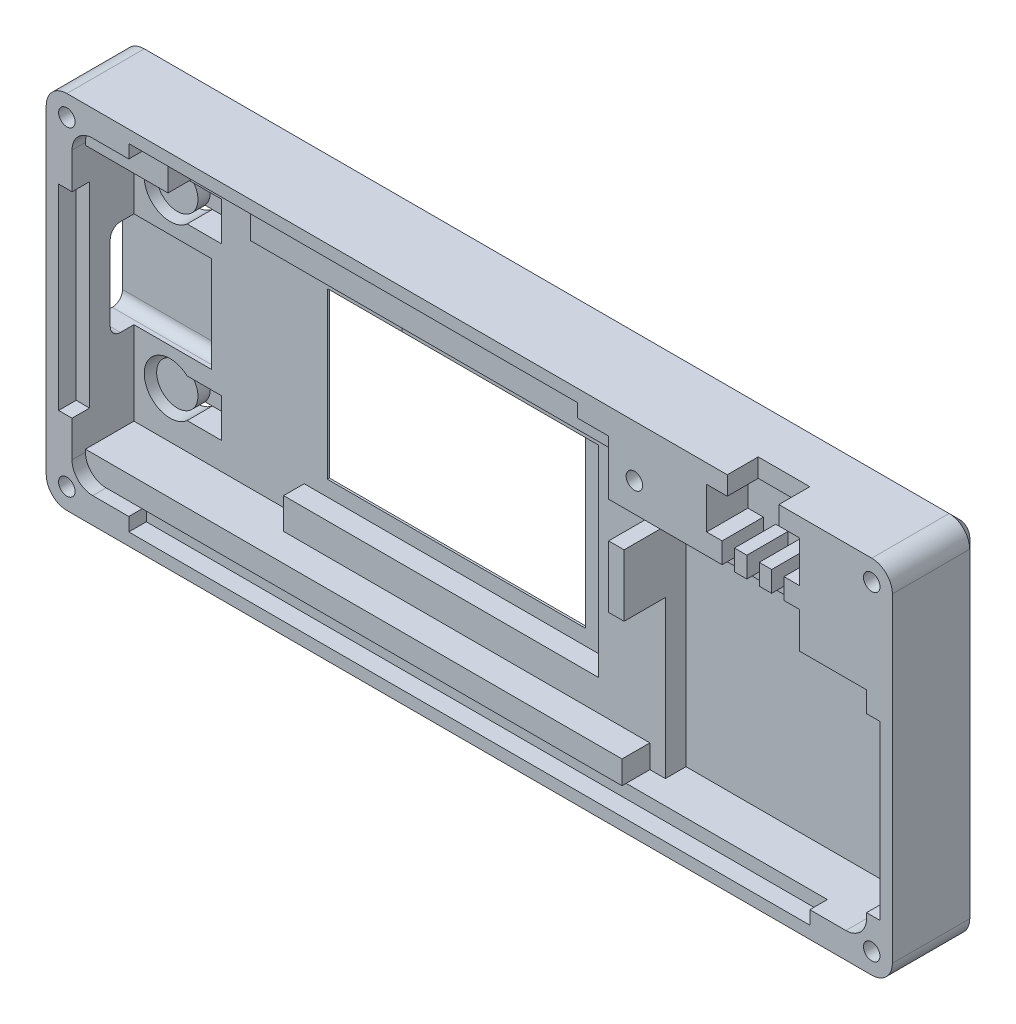
from build123d import *
from build123d.topology import SkipClean

# Parameters (mm, degrees)
SKETCH1_W                = 82
SKETCH1_H                = 35
SKETCH1_W_2              = 25
SKETCH1_H_2              = 16
BOSS_EXTRUDE1_DEPTH      = 2.5
BOSS_EXTRUDE2_DEPTH      = 2
SKETCH1_4_W              = 82
SKETCH1_4_H              = 35
SKETCH1_4_W_2            = 1.5
SKETCH1_4_H_2            = 6
BOSS_EXTRUDE3_DEPTH      = 6
BOSS_EXTRUDE4_DEPTH      = 4.7
SKETCH3_W                = 3.7
SKETCH3_H                = 9.3
CUT_EXTRUDE1_DEPTH       = 10
FILLET1_R                = 1
CUT_EXTRUDE2_DEPTH       = 10
CUT_EXTRUDE5_START       = -2.5
CUT_EXTRUDE5_DEPTH       = 0.7
SKETCH8_W                = 5
SKETCH8_H                = 1.8
SKETCH8_W_2              = 9
SKETCH8_H_2              = 4
CUT_EXTRUDE10_DEPTH      = 4
BOSS_EXTRUDE7_START      = 6
SKETCH1_7_W              = 82
SKETCH1_7_H              = 35
SKETCH1_7_W_2            = 1.5
SKETCH1_7_H_2            = 6
BOSS_EXTRUDE7_DEPTH      = 6
BOSS_EXTRUDE9_START      = -4
SKETCH8_4_W              = 5
SKETCH8_4_H              = 1.8
BOSS_EXTRUDE9_DEPTH      = 1
BOSS_EXTRUDE10_START     = 12
SKETCH1_8_W              = 82
SKETCH1_8_H              = 35
SKETCH1_8_W_2            = 25
SKETCH1_8_H_2            = 16
SKETCH1_8_W_3            = 1.5
SKETCH1_8_H_3            = 6
BOSS_EXTRUDE10_DEPTH     = 2.5
FILLET3_R                = 2
CHAMFER1_SIZE            = 1
CUT_EXTRUDE14_DEPTH      = 6
CUT_EXTRUDE14_DEPTH_BACK = 33
SKETCH10_R               = 0.8
CUT_EXTRUDE12_START      = -17
SKETCH9_2_W              = 121.746640378
SKETCH9_2_H              = 87.215043388
CUT_EXTRUDE12_DEPTH      = 8.5
CUT_EXTRUDE16_START      = -6
SKETCH14_W               = 1.3
SKETCH14_H               = 19
SKETCH14_W_2             = 66
SKETCH14_H_2             = 1.3
SKETCH14_W_3             = 43.5
SKETCH14_H_3             = 16.7
CUT_EXTRUDE16_DEPTH      = 1.7
CUT_EXTRUDE17_START      = -1.2
CUT_EXTRUDE17_DEPTH      = 1.2
SKETCH16_W               = 8
SKETCH16_H               = 2.25
CUT_EXTRUDE18_DEPTH      = 4.7
CHAMFER2_SIZE            = 2.3
CUT_EXTRUDE19_START      = -0.2
CUT_EXTRUDE19_DEPTH      = 0.2


# Read off the part's stored shape, not the designer's step: Cut-Extrude5, Cut-Extrude19
with BuildPart() as part:
    # Sketch1 → Boss-Extrude1 (new body)
    with BuildSketch(Plane.XY):
        Rectangle(SKETCH1_W, SKETCH1_H)
        with Locations((-7.25, -0.25)):
            Rectangle(SKETCH1_W_2, SKETCH1_H_2, mode=Mode.SUBTRACT)
    extrude(amount=-BOSS_EXTRUDE1_DEPTH)

    # Sketch1<3> → Boss-Extrude2 (add)
    with BuildSketch(Plane.XY):
        Polygon((-38.5, 15), (-38.5, 12.75), (-10.5, 12.75), (-10.5, 9.75), (8.5, 9.75), (8.5, -9.75), (-22, -9.75), (-22, -12.75), (13.5, -12.75), (13.5, -15), (15, -15), (15, 6.2), (38.5, 6.2), (38.5, 15), align=None)
    extrude(amount=BOSS_EXTRUDE2_DEPTH)

    # Sketch1<4> → Boss-Extrude3 (add)
    # profile 1 of 3: a face of its own
    with BuildSketch(Plane.XY):
        Rectangle(SKETCH1_4_W, SKETCH1_4_H)
        Polygon((-38.5, -12.75), (-38.5, 12.75), (-38.5, 15), (13.5, 15), (38.5, 15), (38.5, 6.2), (38.5, -15), (15, -15), (13.5, -15), (-38.5, -15), align=None, mode=Mode.SUBTRACT)
    # profile 2 of 3: a face of its own
    with BuildSketch(Plane.XY):
        Polygon((13.5, 15), (13.5, 12.75), (13.5, 6.2), (15, 6.2), (38.5, 6.2), (38.5, 15), align=None)
    # profile 3 of 3: a face of its own
    with BuildSketch(Plane.XY):
        with Locations((14.25, 3.2)):
            Rectangle(SKETCH1_4_W_2, SKETCH1_4_H_2)
    extrude(amount=BOSS_EXTRUDE3_DEPTH)

    # Sketch1<5> → Boss-Extrude4 (add)
    with BuildSketch(Plane.XY):
        Polygon((-38.5, 12.75), (-10.5, 12.75), (13.5, 12.75), (13.5, 15), (-38.5, 15), align=None)
        Polygon((-22, -12.75), (-38.5, -12.75), (-38.5, -15), (13.5, -15), (13.5, -12.75), align=None)
    extrude(amount=BOSS_EXTRUDE4_DEPTH)

    # Sketch3 → Cut-Extrude1 (cut)
    with BuildSketch(Plane.ZY.offset(41)):
        with Locations((0.45, 0)):
            Rectangle(SKETCH3_W, SKETCH3_H)
    extrude(amount=-CUT_EXTRUDE1_DEPTH, mode=Mode.SUBTRACT)

    # Fillet1
    fillet1_edges = [part.edges().sort_by_distance(p)[0] for p in [
        (-36, -4.65, -1.4),
        (-36, 4.65, -1.4),
        (-39.75, 4.65, 2.3),
        (-39.75, -4.65, 2.3),
    ]]
    fillet(fillet1_edges, radius=FILLET1_R)

    # Sketch4 → Cut-Extrude2 (cut)
    with BuildSketch(Plane(origin=(0, 0, -2.5), x_dir=(-1, 0, 0), z_dir=(0, 0, -1))):
        with BuildLine():
            Line((35, 5.75), (35, 6.25))
            ThreePointArc((35, 6.25), (34.183503419, 6.424258142), (33.509288015, 6.916666667))
            Line((33.509288015, 6.916666667), (30, 6.916666667))
            Line((30, 6.916666667), (30, 6.375))
            Line((30, 6.375), (33.346405431, 6.375))
            ThreePointArc((33.346405431, 6.375), (34.116116524, 5.911464133), (35, 5.75))
        make_face()
        with BuildLine():
            ThreePointArc((33.509288015, 9.583333333), (36.825741858, 9.066496581), (35, 6.25))
            Line((35, 6.25), (35, 5.75))
            ThreePointArc((35, 5.75), (37.338535867, 9.133883476), (33.346405431, 10.125))
            Line((33.346405431, 10.125), (30, 10.125))
            Line((30, 10.125), (30, 9.583333333))
            Line((30, 9.583333333), (33.509288015, 9.583333333))
        make_face()
        with BuildLine():
            ThreePointArc((33.346405431, -10.125), (37.338535867, -9.133883476), (35, -5.75))
            Line((35, -5.75), (35, -6.25))
            ThreePointArc((35, -6.25), (36.825741858, -9.066496581), (33.509288015, -9.583333333))
            Line((33.509288015, -9.583333333), (30, -9.583333333))
            Line((30, -9.583333333), (30, -10.125))
            Line((30, -10.125), (33.346405431, -10.125))
        make_face()
        with BuildLine():
            Line((35, -6.25), (35, -5.75))
            ThreePointArc((35, -5.75), (34.116116524, -5.911464133), (33.346405431, -6.375))
            Line((33.346405431, -6.375), (30, -6.375))
            Line((30, -6.375), (30, -6.916666667))
            Line((30, -6.916666667), (33.509288015, -6.916666667))
            ThreePointArc((33.509288015, -6.916666667), (34.183503419, -6.424258142), (35, -6.25))
        make_face()
    extrude(amount=-CUT_EXTRUDE2_DEPTH, mode=Mode.SUBTRACT)

    # Cut-Extrude5 outline → Cut-Extrude5 (cut)
    with BuildSketch(Plane(origin=(0, 0, -2.5), x_dir=(-1, 0, 0), z_dir=(0, 0, -1)).offset(CUT_EXTRUDE5_START)):
        with BuildLine():
            Line((33.509288015, -6.916666667), (30, -6.916666667))
            Line((30, -6.916666667), (30, -9.583333333))
            Line((30, -9.583333333), (33.509288015, -9.583333333))
            ThreePointArc((33.509288015, -9.583333333), (37, -8.25), (33.509288015, -6.916666667))
        make_face()
        with BuildLine():
            Line((33.509288015, 9.583333333), (30, 9.583333333))
            Line((30, 9.583333333), (30, 6.916666667))
            Line((30, 6.916666667), (33.509288015, 6.916666667))
            ThreePointArc((33.509288015, 6.916666667), (37, 8.25), (33.509288015, 9.583333333))
        make_face()
    extrude(amount=CUT_EXTRUDE5_DEPTH, mode=Mode.SUBTRACT)

    # Sketch8 → Cut-Extrude10 (cut)
    with BuildSketch(Plane.XY.offset(6)):
        with Locations((27.5, 16.6)):
            Rectangle(SKETCH8_W, SKETCH8_H)
        with Locations((27.5, 13.7)):
            Rectangle(SKETCH8_W_2, SKETCH8_H_2)
        Polygon((25.7, 11.7), (24.5, 11.7), (24.5, 9.7), (23, 9.7), (23, 6.2), (32, 6.2), (32, 9.7), (30.5, 9.7), (30.5, 11.7), (29.3, 11.7), (29.3, 9.7), (28.1, 9.7), (28.1, 11.7), (26.9, 11.7), (26.9, 9.7), (25.7, 9.7), align=None)
        Polygon((23, 6.2), (23, 9.7), (13.5, 9.7), (13.5, 6.2), (15, 6.2), align=None)
    extrude(amount=-CUT_EXTRUDE10_DEPTH, mode=Mode.SUBTRACT)

    # Sketch1<7> → Boss-Extrude7 (add)
    # profile 1 of 3: a face of its own
    with BuildSketch(Plane.XY.offset(BOSS_EXTRUDE7_START)):
        Rectangle(SKETCH1_7_W, SKETCH1_7_H)
        Polygon((-38.5, -15), (38.5, -15), (38.5, 6.2), (38.5, 15), (-38.5, 15), (-38.5, 12.75), (-38.5, -12.75), align=None, mode=Mode.SUBTRACT)
    # profile 2 of 3: a face of its own
    with BuildSketch(Plane.XY.offset(BOSS_EXTRUDE7_START)):
        Polygon((13.5, 15), (13.5, 12.75), (13.5, 6.2), (15, 6.2), (38.5, 6.2), (38.5, 15), align=None)
    # profile 3 of 3: a face of its own
    with BuildSketch(Plane.XY.offset(BOSS_EXTRUDE7_START)):
        with Locations((14.25, 3.2)):
            Rectangle(SKETCH1_7_W_2, SKETCH1_7_H_2)
    extrude(amount=BOSS_EXTRUDE7_DEPTH)

    # Sketch8<4> → Boss-Extrude9 (add)
    with BuildSketch(Plane.XY.offset(6).offset(BOSS_EXTRUDE9_START)):
        with Locations((27.5, 16.6)):
            Rectangle(SKETCH8_4_W, SKETCH8_4_H)
    extrude(amount=BOSS_EXTRUDE9_DEPTH)

    # Sketch1<8> → Boss-Extrude10 (add)
    # profile 1 of 10: a face of its own
    with BuildSketch(Plane.XY.offset(BOSS_EXTRUDE10_START)):
        Rectangle(SKETCH1_8_W, SKETCH1_8_H)
        Polygon((-38.5, -15), (38.5, -15), (38.5, 6.2), (38.5, 15), (-38.5, 15), (-38.5, 12.75), (-38.5, -12.75), align=None, mode=Mode.SUBTRACT)
    # profile 2 of 10: a face of its own
    with BuildSketch(Plane.XY.offset(BOSS_EXTRUDE10_START)):
        Polygon((-22, -12.75), (-38.5, -12.75), (-38.5, -15), (13.5, -15), (13.5, -12.75), align=None)
    # profile 3 of 10: a face of its own
    with BuildSketch(Plane.XY.offset(BOSS_EXTRUDE10_START)):
        Polygon((-10.5, 9.75), (-10.5, 12.75), (-38.5, 12.75), (-38.5, -12.75), (-22, -12.75), (-22, -9.75), (8.5, -9.75), (8.5, 9.75), align=None)
        with Locations((-7.25, -0.25)):
            Rectangle(SKETCH1_8_W_2, SKETCH1_8_H_2, mode=Mode.SUBTRACT)
    # profile 4 of 10: a face of its own
    with BuildSketch(Plane.XY.offset(BOSS_EXTRUDE10_START)):
        Polygon((13.5, 12.75), (-10.5, 12.75), (-10.5, 9.75), (8.5, 9.75), (8.5, -9.75), (-22, -9.75), (-22, -12.75), (13.5, -12.75), (13.5, 0.2), (13.5, 6.2), align=None)
    # profile 5 of 10: a face of its own
    with BuildSketch(Plane.XY.offset(BOSS_EXTRUDE10_START)):
        Polygon((-38.5, 12.75), (-10.5, 12.75), (13.5, 12.75), (13.5, 15), (-38.5, 15), align=None)
    # profile 6 of 10: a face of its own
    with BuildSketch(Plane.XY.offset(BOSS_EXTRUDE10_START)):
        with Locations((-7.25, -0.25)):
            Rectangle(SKETCH1_8_W_2, SKETCH1_8_H_2)
    # profile 7 of 10: a face of its own
    with BuildSketch(Plane.XY.offset(BOSS_EXTRUDE10_START)):
        Polygon((38.5, 6.2), (15, 6.2), (15, 0.2), (15, -15), (38.5, -15), align=None)
    # profile 8 of 10: a face of its own
    with BuildSketch(Plane.XY.offset(BOSS_EXTRUDE10_START)):
        Polygon((15, 0.2), (13.5, 0.2), (13.5, -12.75), (13.5, -15), (15, -15), align=None)
    # profile 9 of 10: a face of its own
    with BuildSketch(Plane.XY.offset(BOSS_EXTRUDE10_START)):
        Polygon((13.5, 15), (13.5, 12.75), (13.5, 6.2), (15, 6.2), (38.5, 6.2), (38.5, 15), align=None)
    # profile 10 of 10: a face of its own
    with BuildSketch(Plane.XY.offset(BOSS_EXTRUDE10_START)):
        with Locations((14.25, 3.2)):
            Rectangle(SKETCH1_8_W_3, SKETCH1_8_H_3)
    extrude(amount=BOSS_EXTRUDE10_DEPTH)

    # Fillet3
    fillet3_edges = [part.edges().sort_by_distance(p)[0] for p in [
        (41, 17.5, 6),
        (41, -17.5, 6),
        (-41, -17.5, 6),
        (-41, 17.5, 6),
        (-38.5, -15, 8.35),
        (38.5, -15, 6),
        (-38.5, 15, 8.35),
    ]]
    fillet(fillet3_edges, radius=FILLET3_R)

    # Chamfer1
    chamfer1_edges = [part.edges().sort_by_distance(p)[0] for p in [
        (0, 17.5, 14.5),
        (0, 17.5, -2.5),
        (41, 0, 14.5),
        (-41, 0, 14.5),
        (0, -17.5, 14.5),
        (40.414213562, -16.914213562, 14.5),
        (40.414213562, 16.914213562, 14.5),
        (-40.414213562, -16.914213562, 14.5),
        (-40.414213562, 16.914213562, 14.5),
        (-41, 0, -2.5),
        (41, 0, -2.5),
        (0, -17.5, -2.5),
        (40.414213562, -16.914213562, -2.5),
        (40.414213562, 16.914213562, -2.5),
        (-40.414213562, -16.914213562, -2.5),
        (-40.414213562, 16.914213562, -2.5),
    ]]
    chamfer(chamfer1_edges, length=CHAMFER1_SIZE)

    # Sketch10 → Cut-Extrude14 (cut, two sides: drawn at the far end of the back side and taken through both)
    with BuildSketch(Plane(origin=(0, 0, 6), x_dir=(-1, 0, 0), z_dir=(0, 0, -1)).offset(-CUT_EXTRUDE14_DEPTH_BACK)):
        with Locations((-39, 15.5)):
            Circle(SKETCH10_R)
        with Locations((-16, 12.5)):
            Circle(SKETCH10_R)
        with Locations((39.003800828, 15.5)):
            Circle(SKETCH10_R)
        with Locations((39.003800828, -15.5)):
            Circle(SKETCH10_R)
        with Locations((-39, -15.5)):
            Circle(SKETCH10_R)
    extrude(amount=CUT_EXTRUDE14_DEPTH + CUT_EXTRUDE14_DEPTH_BACK, mode=Mode.SUBTRACT)

    # Sketch9<2> → Cut-Extrude12 (cut)
    with BuildSketch(Plane(origin=(0, 0, -2.5), x_dir=(-1, 0, 0), z_dir=(0, 0, -1)).offset(CUT_EXTRUDE12_START)):
        Rectangle(SKETCH9_2_W, SKETCH9_2_H)
    extrude(amount=CUT_EXTRUDE12_DEPTH, mode=Mode.SUBTRACT)

    # Sketch14 → Cut-Extrude16 (cut)
    with BuildSketch(Plane.XY.offset(12).offset(CUT_EXTRUDE16_START)):
        with Locations((-39.15, 0)):
            Rectangle(SKETCH14_W, SKETCH14_H)
        with Locations((0, -15.65)):
            Rectangle(SKETCH14_W_2, SKETCH14_H_2)
        with Locations((-11.25, 15.65)):
            Rectangle(SKETCH14_W_3, SKETCH14_H_2)
        with Locations((39.15, -4.15)):
            Rectangle(SKETCH14_W, SKETCH14_H_3)
    extrude(amount=-CUT_EXTRUDE16_DEPTH, mode=Mode.SUBTRACT)

    # Sketch15 → Cut-Extrude17 (cut)
    with SkipClean():  # the faces are left unmerged after this step: merging them gives an invalid solid
        with BuildSketch(Plane.XY.offset(-0.7).offset(CUT_EXTRUDE17_START)):
            with BuildLine():
                Line((-30, 9.583333333), (-33.509288015, 9.583333333))
                ThreePointArc((-33.509288015, 9.583333333), (-33.131655282, 8.96364418), (-33, 8.25))
                ThreePointArc((-33, 8.25), (-33.131655282, 7.53635582), (-33.509288015, 6.916666667))
                Line((-33.509288015, 6.916666667), (-30, 6.916666667))
                Line((-30, 6.916666667), (-30, 9.583333333))
            make_face()
            with BuildLine():
                Line((-30, -6.916666667), (-33.509288015, -6.916666667))
                ThreePointArc((-33.509288015, -6.916666667), (-33.131655282, -7.53635582), (-33, -8.25))
                ThreePointArc((-33, -8.25), (-33.131655282, -8.96364418), (-33.509288015, -9.583333333))
                Line((-33.509288015, -9.583333333), (-30, -9.583333333))
                Line((-30, -9.583333333), (-30, -6.916666667))
            make_face()
        extrude(amount=CUT_EXTRUDE17_DEPTH, mode=Mode.SUBTRACT)

    # Sketch16 → Cut-Extrude18 (cut)
    with SkipClean():  # the faces are left unmerged after this step: merging them gives an invalid solid
        with BuildSketch(Plane.XY.offset(4.7)):
            with Locations((-26.5, 13.875)):
                Rectangle(SKETCH16_W, SKETCH16_H)
        extrude(amount=-CUT_EXTRUDE18_DEPTH, mode=Mode.SUBTRACT)

    # Chamfer2
    chamfer2_edges = [part.edges().sort_by_distance(p)[0] for p in [
        (5.25, -0.25, -2.5),
        (-7.25, -8.25, -2.5),
        (-19.75, -0.25, -2.5),
        (-7.25, 7.75, -2.5),
    ]]
    chamfer(chamfer2_edges, length=CHAMFER2_SIZE)

    # Cut-Extrude19 outline → Cut-Extrude19 (cut)
    with SkipClean():  # the faces are left unmerged after this step: merging them gives an invalid solid
        with BuildSketch(Plane(origin=(0, 0, -2.5), x_dir=(-1, 0, 0), z_dir=(0, 0, -1)).offset(CUT_EXTRUDE19_START)):
            with BuildLine():
                Line((-28.00274578, -7.497433164), (-30.961284351, -10.455618193))
                ThreePointArc((-30.961284351, -10.455618193), (-31.214250116, -11.44266334), (-30.47046462, -12.139106401))
                ThreePointArc((-30.47046462, -12.139106401), (-24.191961209, -10.308613416), (-22.360717917, -4.030328805))
                ThreePointArc((-22.360717917, -4.030328805), (-23.057072086, -3.286460085), (-24.044147457, -3.53930789))
                Line((-24.044147457, -3.53930789), (-27.002686028, -6.497492919))
                Line((-27.002686028, -6.497492919), (-28.000000002, -5.500059753))
                ThreePointArc((-28.000000002, -5.500059753), (-29.707064528, -4.792850968), (-29.000059753, -6.499999998))
                Line((-29.000059753, -6.499999998), (-28.00274578, -7.497433164))
            make_face()
            with BuildLine():
                ThreePointArc((-28.999578741, 1.549999987), (-28.049521977, 2.49994322), (-28.99946521, 3.449999984))
                ThreePointArc((-28.99946521, 3.449999984), (-35.328227527, 0.828983834), (-37.949999984, -5.49946521))
                ThreePointArc((-37.949999984, -5.49946521), (-37.000056751, -6.449521974), (-36.049999987, -5.499578741))
                ThreePointArc((-36.049999987, -5.499578741), (-33.984804923, -0.514599326), (-28.999578741, 1.549999987))
            make_face()
            with BuildLine():
                ThreePointArc((-28.999817753, -2.450000005), (-28.049760989, -1.500056773), (-28.999704222, -0.550000009))
                ThreePointArc((-28.999704222, -0.550000009), (-32.499969414, -1.999612293), (-33.949999991, -5.499704222))
                ThreePointArc((-33.949999991, -5.499704222), (-33.000056759, -6.449760986), (-32.049999995, -5.499817753))
                ThreePointArc((-32.049999995, -5.499817753), (-31.156546811, -3.343195453), (-28.999817753, -2.450000005))
            make_face()
        extrude(amount=CUT_EXTRUDE19_DEPTH, mode=Mode.SUBTRACT)


solid = part.part
